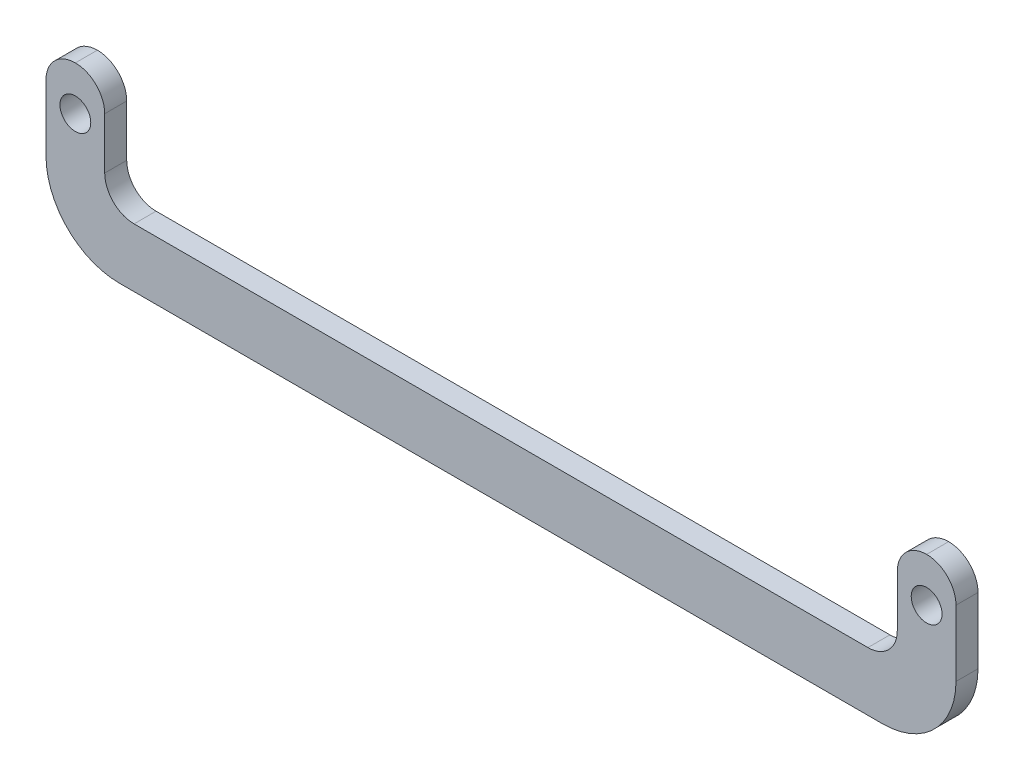
from build123d import *

# Parameters (mm, degrees)
SKETCH_1_W          = 124
SKETCH_1_H          = 8
EXTRUDE_1_DEPTH     = 3
SKETCH_2_W          = 8
SKETCH_2_H          = 23
EXTRUDE_2_DEPTH     = 3
SKETCH_3_R          = 2.1
CUT_EXTRUDE_1_DEPTH = 65.915329468
FILLET_1_R          = 10
FILLET_2_R          = 4


with BuildPart() as part:
    # 草圖1 → 填料-伸長1 (new body)
    with BuildSketch(Plane.XY):
        Rectangle(SKETCH_1_W, SKETCH_1_H)
    extrude(amount=EXTRUDE_1_DEPTH)

    # 草圖2 → 填料-伸長2 (add)
    with BuildSketch(Plane.XY.offset(3)):
        with Locations((-58, 7.5)):
            Rectangle(SKETCH_2_W, SKETCH_2_H)
    extrude_2 = extrude(amount=-EXTRUDE_2_DEPTH)

    # 草圖3 → 除料-伸長1 (cut, through all)
    with BuildSketch(Plane.XY.offset(3)):
        with Locations((-58, 13)):
            Circle(SKETCH_3_R)
    cut_extrude_1 = extrude(amount=-CUT_EXTRUDE_1_DEPTH, mode=Mode.SUBTRACT)

    # 鏡射1: 填料-伸長2, 除料-伸長1 across plane
    add(extrude_2.mirror(Plane(origin=(0, 0, 0), x_dir=(0, 0, 1), z_dir=(1, 0, 0))))
    add(cut_extrude_1.mirror(Plane(origin=(0, 0, 0), x_dir=(0, 0, 1), z_dir=(1, 0, 0))), mode=Mode.SUBTRACT)

    # 圓角1
    fillet_1_edges = [part.edges().sort_by_distance(p)[0] for p in [
        (62, -4, 1.5),
        (-62, -4, 1.5),
    ]]
    fillet(fillet_1_edges, radius=FILLET_1_R)

    # 圓角2
    # the kernel refuses this fillet: 4 mm, written as the material it adds along each edge
    with BuildSketch(Plane(origin=(-54, 4, 0), x_dir=(0, 1, 0), z_dir=(0, 0, 1)), Plane(origin=(54, 4, 0), x_dir=(-1, 0, 0), z_dir=(0, 0, 1))) as fillet_2_piece_1:
        with BuildLine():
            CenterArc((FILLET_2_R, -FILLET_2_R), FILLET_2_R, 90, 90)
            Line((0, -FILLET_2_R), (0, 0))
            Line((0, 0), (FILLET_2_R, 0))
        make_face()
    extrude(amount=3)
    # the kernel refuses this fillet: 4 mm, written as the material it takes off along each edge
    with BuildSketch(Plane(origin=(62, 19, 13), x_dir=(0, -1, 0), z_dir=(0, 0, -1))) as fillet_2_2_piece_1:
        with BuildLine():
            CenterArc((FILLET_2_R, FILLET_2_R), FILLET_2_R, 180, 90)
            Line((0, FILLET_2_R), (0, 0))
            Line((0, 0), (FILLET_2_R, 0))
        make_face()
    extrude(amount=23, mode=Mode.SUBTRACT)
    with BuildSketch(Plane(origin=(54, 19, 13), x_dir=(0, -1, 0), z_dir=(0, 0, -1)), Plane(origin=(-54, 19, 13), x_dir=(-1, 0, 0), z_dir=(0, 0, -1)), Plane(origin=(-62, 19, 13), x_dir=(0, -1, 0), z_dir=(0, 0, -1))) as fillet_2_2_piece_2:
        with BuildLine():
            CenterArc((FILLET_2_R, -FILLET_2_R), FILLET_2_R, 90, 90)
            Line((0, -FILLET_2_R), (0, 0))
            Line((0, 0), (FILLET_2_R, 0))
        make_face()
    extrude(amount=23, mode=Mode.SUBTRACT)


solid = part.part
